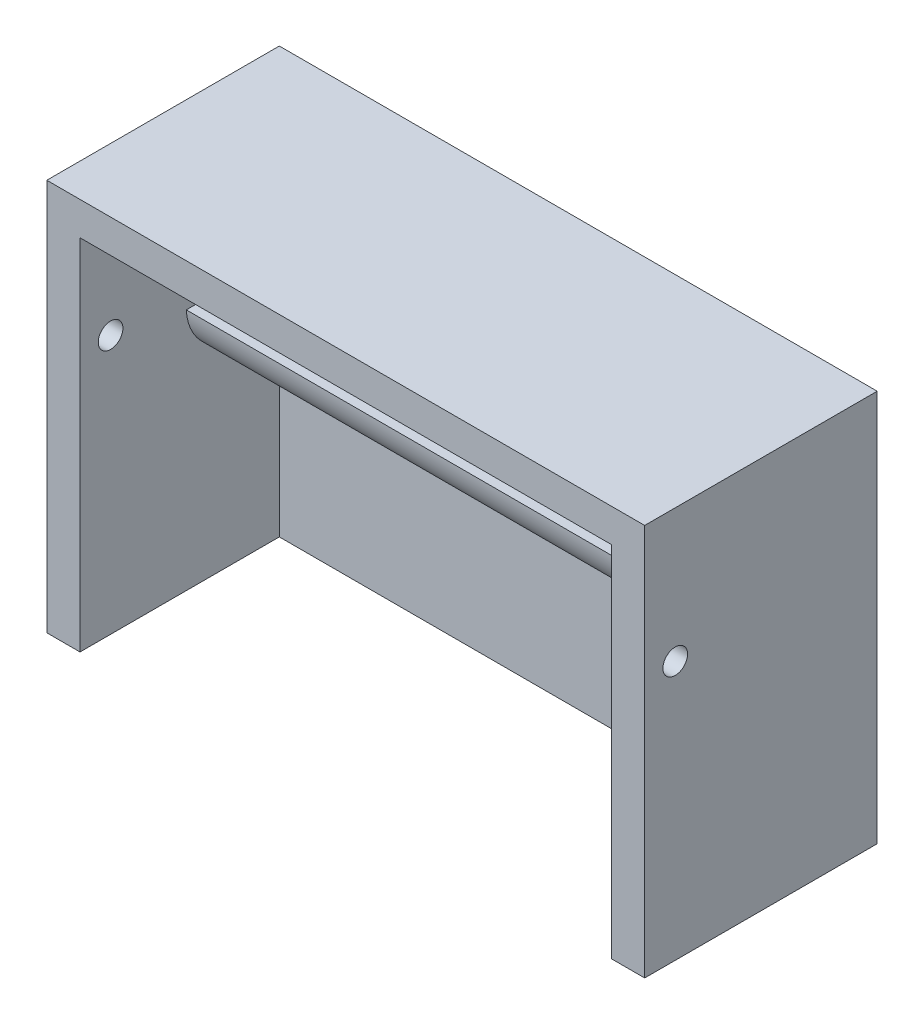
from build123d import *

# Parameters (mm, degrees)
BOSS_EXTRUDE1_DEPTH = 44.45
SKETCH2_W           = 50.8
SKETCH2_H           = 6.35
BOSS_EXTRUDE2_DEPTH = 68.58
CUT_EXTRUDE1_REACH  = 90.148
SKETCH3_R           = 2.35585
SKETCH4_W           = 101.6
SKETCH4_H           = 9.652
BOSS_EXTRUDE3_DEPTH = 17.78
FILLET1_R           = 10.16


with BuildPart() as part:
    # Sketch1 → Boss-Extrude1 (new body)
    with BuildSketch(Plane.XY):
        Polygon((0, 43.931028897), (50.8, 43.931028897), (50.8, -24.648971103), (57.15, -24.648971103), (57.15, 50.281028897), (0, 50.281028897), align=None)
    boss_extrude1 = extrude(amount=BOSS_EXTRUDE1_DEPTH)

    # Sketch2 → Boss-Extrude2 (add)
    with BuildSketch(Plane.XZ.offset(-43.931028897)):
        with Locations((25.4, 3.175)):
            Rectangle(SKETCH2_W, SKETCH2_H)
    boss_extrude2 = extrude(amount=BOSS_EXTRUDE2_DEPTH)

    # Sketch3 → Cut-Extrude1 (cut, up to next)
    with BuildSketch(Plane(origin=(57.15, 0, 0), x_dir=(0, 0, -1), z_dir=(1, 0, 0)), mode=Mode.PRIVATE) as cut_extrude1_sk1:
        with Locations(Location((-38.608, 24.881028897, 0), (0, 0, 90))):
            Circle(SKETCH3_R)
    cut_extrude1_tool1 = extrude(cut_extrude1_sk1.sketch, amount=-CUT_EXTRUDE1_REACH, mode=Mode.PRIVATE) & part.part
    cut_extrude1 = cut_extrude1_tool1.solids().sort_by_distance((57.15, 24.881029, 38.608))[0]
    add(cut_extrude1, mode=Mode.SUBTRACT)

    # Mirror1: Boss-Extrude1, Boss-Extrude2, Cut-Extrude1 across plane
    add(boss_extrude1.mirror(Plane(origin=(0, 0, 0), x_dir=(0, 0, 1), z_dir=(1, 0, 0))))
    add(boss_extrude2.mirror(Plane(origin=(0, 0, 0), x_dir=(0, 0, 1), z_dir=(1, 0, 0))))
    add(cut_extrude1.mirror(Plane(origin=(0, 0, 0), x_dir=(0, 0, 1), z_dir=(1, 0, 0))), mode=Mode.SUBTRACT)

    # Sketch4 → Boss-Extrude3 (add)
    with BuildSketch(Plane.XY.offset(6.35)):
        with Locations((0, 17.007028897)):
            Rectangle(SKETCH4_W, SKETCH4_H)
    extrude(amount=BOSS_EXTRUDE3_DEPTH)

    # Fillet1
    # the kernel refuses this fillet: 10.16 mm, written as the material it takes off along each edge
    with BuildSketch(Plane(origin=(50.8, 12.181028897, 24.13), x_dir=(0, 1, 0), z_dir=(-1, 0, 0))) as fillet1_piece_1:
        with BuildLine():
            CenterArc((10.16, 10.147292053), FILLET1_R, 180, 87.134016017)
            Line((0, 10.147292053), (0, 0))
            Line((0, 0), (9.652, 0))
        make_face()
    extrude(amount=101.6, mode=Mode.SUBTRACT)


solid = part.part
